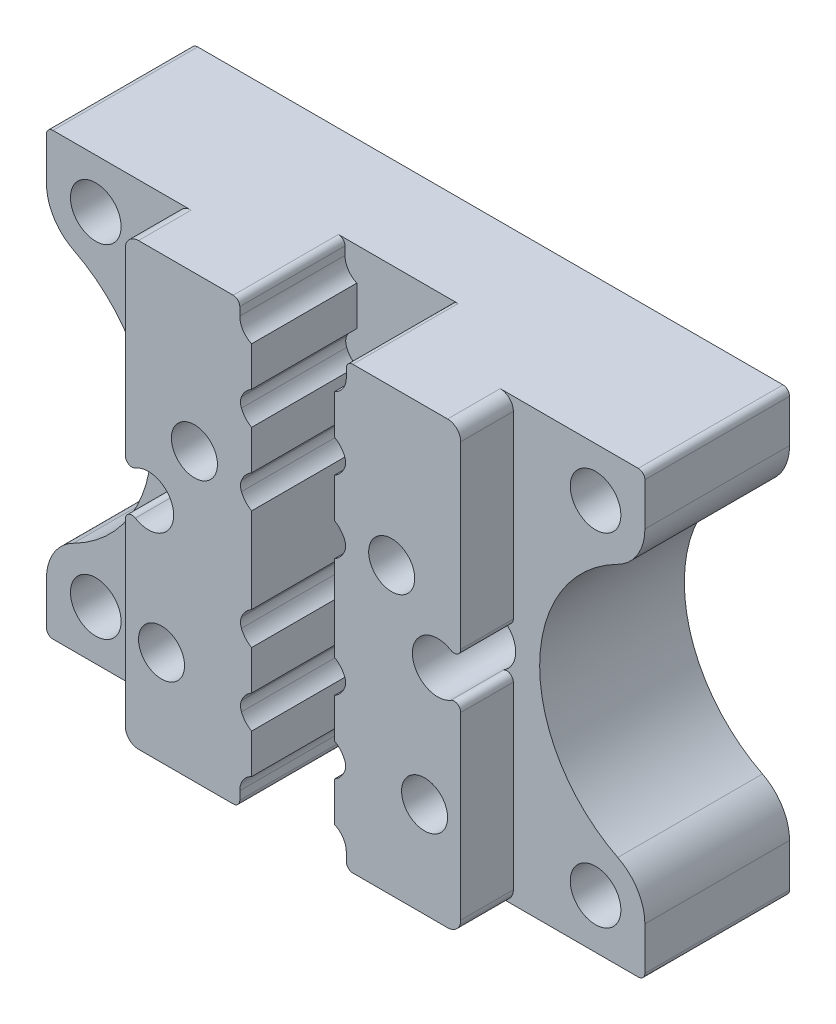
from build123d import *

# Parameters (mm, degrees)
SKETCH1_R           = 1.75
SKETCH1_R_2         = 1.925
BOSS_EXTRUDE1_DEPTH = 15
CUT_EXTRUDE1_DEPTH  = 8
SKETCH5_W           = 11
SKETCH5_H           = 33.5
CUT_EXTRUDE6_DEPTH  = 4
SKETCH8_R           = 1.75
CUT_EXTRUDE9_DEPTH  = 14
FILLET1_R           = 1.75
FILLET2_R           = 1
FILLET3_R           = 0.5
FILLET4_R           = 1.5


with BuildPart() as part:
    # Sketch1 → Boss-Extrude1 (new body)
    with BuildSketch(Plane.XY):
        with BuildLine():
            Line((-19, 16.75), (19, 16.75))
            Line((19, 16.75), (22.75, 16.75))
            Line((22.75, 16.75), (22.75, 13))
            ThreePointArc((22.75, 13), (22.193718688, 11.034634654), (20.689914163, 9.652360515))
            ThreePointArc((20.689914163, 9.652360515), (14.75, 0), (20.689914163, -9.652360515))
            ThreePointArc((20.689914163, -9.652360515), (22.193718688, -11.034634654), (22.75, -13))
            Line((22.75, -13), (22.75, -16.75))
            Line((22.75, -16.75), (19, -16.75))
            Line((19, -16.75), (-19, -16.75))
            Line((-19, -16.75), (-22.75, -16.75))
            Line((-22.75, -16.75), (-22.75, -13))
            ThreePointArc((-22.75, -13), (-22.193718688, -11.034634654), (-20.689914163, -9.652360515))
            ThreePointArc((-20.689914163, -9.652360515), (-14.75, 0), (-20.689914163, 9.652360515))
            ThreePointArc((-20.689914163, 9.652360515), (-22.193718688, 11.034634654), (-22.75, 13))
            Line((-22.75, 13), (-22.75, 16.75))
            Line((-22.75, 16.75), (-19, 16.75))
        make_face()
        with Locations((-10, -9.5)):
            Circle(SKETCH1_R, mode=Mode.SUBTRACT)
        with Locations((10, -9.5)):
            Circle(SKETCH1_R, mode=Mode.SUBTRACT)
        with Locations((19, 13)):
            Circle(SKETCH1_R_2, mode=Mode.SUBTRACT)
        with Locations((-19, 13)):
            Circle(SKETCH1_R_2, mode=Mode.SUBTRACT)
        with Locations((-19, -13)):
            Circle(SKETCH1_R_2, mode=Mode.SUBTRACT)
        with Locations((19, -13)):
            Circle(SKETCH1_R_2, mode=Mode.SUBTRACT)
        with Locations((-11, 0)):
            Circle(SKETCH1_R_2, mode=Mode.SUBTRACT)
        with Locations((11, 0)):
            Circle(SKETCH1_R_2, mode=Mode.SUBTRACT)
    extrude(amount=BOSS_EXTRUDE1_DEPTH)

    # Sketch2 → Cut-Extrude1 (cut)
    with BuildSketch(Plane.XY.offset(15)):
        Polygon((-4.049999999, 16.75), (-4.049999999, 14.25), (-3.149999999, 14.25), (-3.149999999, 11.25), (-4.049999999, 11.25), (-4.049999999, 8.75), (-3.149999999, 8.75), (-3.149999999, 5.75), (-4.049999999, 5.75), (-4.049999999, 3.25), (-3.149999999, 3.25), (-3.149999999, -3.25), (-4.049999999, -3.25), (-4.049999999, -5.75), (-3.149999999, -5.75), (-3.149999999, -8.75), (-4.049999999, -8.75), (-4.049999999, -11.25), (-3.149999999, -11.25), (-3.149999999, -14.25), (-4.049999999, -14.25), (-4.049999999, -16.75), (4.050000001, -16.75), (4.050000001, -14.25), (3.150000001, -14.25), (3.150000001, -11.25), (4.050000001, -11.25), (4.050000001, -8.75), (3.150000001, -8.75), (3.150000001, -5.75), (4.050000001, -5.75), (4.050000001, -3.25), (3.150000001, -3.25), (3.150000001, 3.25), (4.050000001, 3.25), (4.050000001, 5.75), (3.150000001, 5.75), (3.150000001, 8.75), (4.050000001, 8.75), (4.050000001, 11.25), (3.150000001, 11.25), (3.150000001, 14.25), (4.050000001, 14.25), (4.050000001, 16.75), align=None)
    extrude(amount=-CUT_EXTRUDE1_DEPTH, mode=Mode.SUBTRACT)

    # Sketch5 → Cut-Extrude6 (cut)
    with BuildSketch(Plane.XY.offset(15)):
        with Locations((-18.25, 0)):
            Rectangle(SKETCH5_W, SKETCH5_H)
        with Locations((18.25, 0)):
            Rectangle(SKETCH5_W, SKETCH5_H)
    extrude(amount=-CUT_EXTRUDE6_DEPTH, mode=Mode.SUBTRACT)

    # Sketch8 → Cut-Extrude9 (cut)
    with BuildSketch(Plane.XY.offset(15)):
        with Locations((7.5, 5)):
            Circle(SKETCH8_R)
        with Locations((-7.5, 5)):
            Circle(SKETCH8_R)
    extrude(amount=-CUT_EXTRUDE9_DEPTH, mode=Mode.SUBTRACT)

    # Fillet1
    # the kernel refuses this fillet: 1.75 mm, written as the material it adds along each edge
    with BuildSketch(Plane(origin=(-4.049999999, 11.25, 15), x_dir=(1, 0, 0), z_dir=(0, 0, -1)), Plane(origin=(-4.049999999, 5.75, 15), x_dir=(1, 0, 0), z_dir=(0, 0, -1)), Plane(origin=(-4.049999999, -3.25, 15), x_dir=(1, 0, 0), z_dir=(0, 0, -1)), Plane(origin=(-4.049999999, -8.75, 15), x_dir=(1, 0, 0), z_dir=(0, 0, -1)), Plane(origin=(4.050000001, -11.25, 15), x_dir=(-1, 0, 0), z_dir=(0, 0, -1))) as fillet1_piece_1:
        with BuildLine():
            CenterArc((1.75, 1.529705854), FILLET1_R, 180, 60.940718932)
            Line((0, 1.529705854), (-0.035, 1.529705854))
            Line((-0.035, 1.529705854), (-0.035, 0))
            Line((-0.035, 0), (0, -0.035))
            ThreePointArc((0, -0.035), (0.45, -0.035), (0.883, -0.030594117))
            Line((0.883, -0.030594117), (0.9, 0))
        make_face()
    extrude(amount=11.824264635)
    with BuildSketch(Plane(origin=(4.050000001, 11.25, 15), x_dir=(-1, 0, 0), z_dir=(0, 0, -1)), Plane(origin=(4.050000001, 5.75, 15), x_dir=(-1, 0, 0), z_dir=(0, 0, -1)), Plane(origin=(4.050000001, -3.25, 15), x_dir=(-1, 0, 0), z_dir=(0, 0, -1))) as fillet1_piece_2:
        with BuildLine():
            CenterArc((1.75, -1.529705854), FILLET1_R, 119.059281068, 60.940718932)
            Line((0, -1.529705854), (-0.035, -1.529705854))
            Line((-0.035, -1.529705854), (-0.035, 0))
            Line((-0.035, 0), (0, 0.035))
            ThreePointArc((0, 0.035), (0.45, 0.035), (0.883, 0.030594117))
            Line((0.883, 0.030594117), (0.9, 0))
        make_face()
    extrude(amount=11.824264635)
    with BuildSketch(Plane(origin=(4.050000001, -8.75, 15), x_dir=(0, -1, 0), z_dir=(0, 0, -1)), Plane(origin=(-4.049999999, 8.75, 15), x_dir=(0, 1, 0), z_dir=(0, 0, -1)), Plane(origin=(-4.049999999, 3.25, 15), x_dir=(0, 1, 0), z_dir=(0, 0, -1)), Plane(origin=(-4.049999999, -5.75, 15), x_dir=(0, 1, 0), z_dir=(0, 0, -1)), Plane(origin=(-4.049999999, -11.25, 15), x_dir=(0, 1, 0), z_dir=(0, 0, -1))) as fillet1_piece_3:
        with BuildLine():
            CenterArc((1.529705854, 1.75), FILLET1_R, 209.059281068, 60.940718932)
            Line((0, 0.9), (-0.030594117, 0.883))
            ThreePointArc((-0.030594117, 0.883), (-0.035, 0.45), (-0.035, 0))
            Line((-0.035, 0), (0, -0.035))
            Line((0, -0.035), (1.529705854, -0.035))
            Line((1.529705854, -0.035), (1.529705854, 0))
        make_face()
    extrude(amount=11.824264635)
    with BuildSketch(Plane(origin=(4.050000001, -5.75, 15), x_dir=(0, 1, 0), z_dir=(0, 0, -1)), Plane(origin=(4.050000001, 3.25, 15), x_dir=(0, 1, 0), z_dir=(0, 0, -1)), Plane(origin=(4.050000001, 8.75, 15), x_dir=(0, 1, 0), z_dir=(0, 0, -1))) as fillet1_piece_4:
        with BuildLine():
            CenterArc((1.529705854, -1.75), FILLET1_R, 90, 60.940718932)
            Line((0, -0.9), (-0.030594117, -0.883))
            ThreePointArc((-0.030594117, -0.883), (-0.035, -0.45), (-0.035, 0))
            Line((-0.035, 0), (0, 0.035))
            Line((0, 0.035), (1.529705854, 0.035))
            Line((1.529705854, 0.035), (1.529705854, 0))
        make_face()
    extrude(amount=11.824264635)

    # Fillet2
    fillet2_edges = [part.edges().sort_by_distance(p)[0] for p in [
        (-12.75, -16.75, 13),
        (-12.75, 16.75, 13),
        (12.75, 16.75, 13),
        (12.75, -16.75, 13),
        (-4.027502426, 10, 11),
        (-4.027502426, 4.5, 11),
        (-4.027502426, -4.5, 11),
        (-4.027502426, -10, 11),
        (4.027502428, 10, 11),
        (4.027502428, 4.5, 11),
        (4.027502428, -4.5, 11),
        (4.027502428, -10, 11),
    ]]
    fillet(fillet2_edges, radius=FILLET2_R)

    # Fillet3
    fillet3_edges = [part.edges().sort_by_distance(p)[0] for p in [
        (-4.049999999, 16.75, 11),
        (4.050000001, 16.75, 11),
        (4.050000001, -16.75, 11),
        (-4.049999999, -16.75, 11),
        (-12.75, 0.801950747, 13),
        (-12.75, -0.801950747, 13),
        (-22.75, -16.75, 5.5),
        (-22.75, 16.75, 5.5),
        (12.75, -0.801950747, 13),
        (12.75, 0.801950747, 13),
        (22.75, -16.75, 5.5),
        (22.75, 16.75, 5.5),
    ]]
    fillet(fillet3_edges, radius=FILLET3_R)

    # Fillet4
    # the kernel refuses this fillet: 1.5 mm, written as the material it adds along each edge
    with BuildSketch(Plane(origin=(-4.049999999, 14.25, 15), x_dir=(1, 0, 0), z_dir=(0, 0, -1)), Plane(origin=(4.050000001, -14.25, 15), x_dir=(-1, 0, 0), z_dir=(0, 0, -1))) as fillet4_piece_1:
        with BuildLine():
            CenterArc((1.5, -1.374772708), FILLET4_R, 113.578178478, 66.421821522)
            Line((0, -1.374772708), (-0.03, -1.374772708))
            Line((-0.03, -1.374772708), (-0.03, 0))
            Line((-0.03, 0), (0, 0.03))
            ThreePointArc((0, 0.03), (0.45, 0.03), (0.888, 0.027495454))
            Line((0.888, 0.027495454), (0.9, 0))
        make_face()
    extrude(amount=11.436931771)
    with BuildSketch(Plane(origin=(4.050000001, 14.25, 15), x_dir=(-1, 0, 0), z_dir=(0, 0, -1)), Plane(origin=(-4.049999999, -14.25, 15), x_dir=(1, 0, 0), z_dir=(0, 0, -1))) as fillet4_piece_2:
        with BuildLine():
            CenterArc((1.5, 1.374772708), FILLET4_R, 180, 66.421821522)
            Line((0, 1.374772708), (-0.03, 1.374772708))
            Line((-0.03, 1.374772708), (-0.03, 0))
            Line((-0.03, 0), (0, -0.03))
            ThreePointArc((0, -0.03), (0.45, -0.03), (0.888, -0.027495454))
            Line((0.888, -0.027495454), (0.9, 0))
        make_face()
    extrude(amount=11.436931771)


solid = part.part
